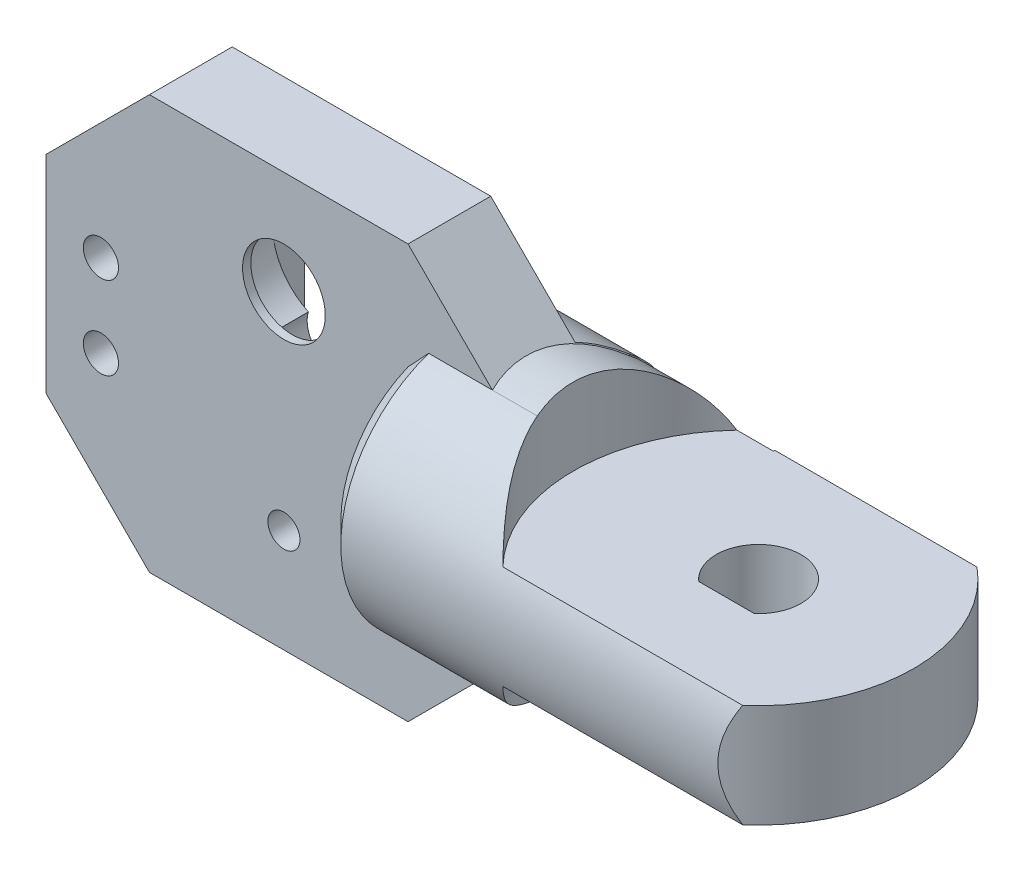
from build123d import *

# Parameters (mm, degrees)
SKETCH_1_W           = 50
SKETCH_1_H           = 40
EXTRUDE_1_DEPTH      = 8
CHAMFER_1_SIZE       = 10
SKETCH_2_R           = 1.55
CUT_EXTRUDE_1_DEPTH  = 10
EXTRUDE_2_DEPTH      = 30
EXTRUDE_2_DEPTH_BACK = 15
SKETCH_3_R           = 12.5
SKETCH_4_R           = 1.7
CUT_EXTRUDE_2_DEPTH  = 15
CUT_EXTRUDE_START    = -20
CUT_EXTRUDE_3_DEPTH  = 20
SKETCH_7_R           = 16.5
CUT_EXTRUDE_8_DEPTH  = 33
CUT_EXTRUDE_9_DEPTH  = 20
CHAMFER_3_SIZE       = 2
CUT_EXTRUDE_START_2  = 20
SKETCH_10_OUTSIDE_W  = 45.574
SKETCH_10_OUTSIDE_H  = 60.574
SKETCH_10_OUTSIDE_R  = 12.466047995
CUT_EXTRUDE_10_DEPTH = 10
CHAMFER_4_SIZE       = 10
SKETCH_14_W          = 12
SKETCH_14_H          = 23
CUT_EXTRUDE_11_DEPTH = 3
CUT_EXTRUDE_12_DEPTH = 4.2
SKETCH_16_R          = 1.1
CUT_EXTRUDE_13_DEPTH = 5
SKETCH_17_R          = 3.372674955
EXTRUDE_3_DEPTH      = 4
SKETCH_18_R          = 1.1
CUT_EXTRUDE_14_DEPTH = 4
SKETCH_20_R          = 4
CUT_EXTRUDE_15_DEPTH = 4
CUT_EXTRUDE_17_DEPTH = 10


# Read off the part's stored shape, not the designer's step: 切除-拉伸3
with BuildPart() as part:
    # 草图1 → 凸台-拉伸1 (new body)
    with BuildSketch(Plane.XY):
        Rectangle(SKETCH_1_W, SKETCH_1_H)
    extrude(amount=EXTRUDE_1_DEPTH)

    # 倒角1
    chamfer_1_edges = [part.edges().sort_by_distance(p)[0] for p in [
        (-25, -20, 4),
        (-25, 20, 4),
    ]]
    chamfer(chamfer_1_edges, length=CHAMFER_1_SIZE)

    # 草图2 → 切除-拉伸1 (cut)
    with BuildSketch(Plane.XY.offset(8)):
        with Locations((-2, -10)):
            Circle(SKETCH_2_R)
        with Locations((-2, 10)):
            Circle(SKETCH_2_R)
    extrude(amount=-CUT_EXTRUDE_1_DEPTH, mode=Mode.SUBTRACT)

    # 草图3 → 凸台-拉伸2 (add, two sides: drawn at the far end of the back side and taken through both)
    with BuildSketch(Plane(origin=(25, 0, 0), x_dir=(0, 0, -1), z_dir=(1, 0, 0)).offset(-EXTRUDE_2_DEPTH_BACK)):
        with Locations(Location((-4, 0, 0), (0, 0, 251.337075115))):
            Circle(SKETCH_3_R)
    extrude(amount=EXTRUDE_2_DEPTH + EXTRUDE_2_DEPTH_BACK)

    # 草图4 → 切除-拉伸2 (cut)
    with BuildSketch(Plane.XY.offset(8)):
        with Locations((-19.690178066, -4)):
            Circle(SKETCH_4_R)
        with Locations((-19.690178066, 4)):
            Circle(SKETCH_4_R)
    extrude(amount=-CUT_EXTRUDE_2_DEPTH, mode=Mode.SUBTRACT)

    # 切除-拉伸3 outline → 切除-拉伸3 (cut)
    with BuildSketch(Plane(origin=(55, 0, 0), x_dir=(0, 0, -1), z_dir=(1, 0, 0)).offset(CUT_EXTRUDE_START)):
        with BuildLine():
            Line((7.456439237, -5), (-15.456439237, -5))
            ThreePointArc((-15.456439237, -5), (-4, -12.5), (7.456439237, -5))
        make_face()
        with BuildLine():
            ThreePointArc((7.456439237, 5), (-4, 12.5), (-15.456439237, 5))
            Line((-15.456439237, 5), (7.456439237, 5))
        make_face()
    extrude(amount=CUT_EXTRUDE_3_DEPTH, mode=Mode.SUBTRACT)

    # 草图7 → 切除-拉伸8 (cut)
    with BuildSketch(Plane.XZ.offset(5)):
        with Locations((38.5, 4)):
            Circle(SKETCH_7_R)
    cut_extrude_8 = extrude(amount=CUT_EXTRUDE_8_DEPTH, mode=Mode.SUBTRACT)

    # 镜向1: 切除-拉伸8 across plane
    add(cut_extrude_8.mirror(Plane.ZX), mode=Mode.SUBTRACT)

    # 草图8 → 切除-拉伸9 (cut)
    with BuildSketch(Plane.XZ.offset(5)):
        with BuildLine():
            Line((40, 19.107397707), (75.764252489, 33.62580965))
            Line((75.764252489, 33.62580965), (78.826270749, -18.347337912))
            Line((78.826270749, -18.347337912), (40, -10.892602293))
            ThreePointArc((40, -10.892602293), (55, 4.107397707), (40, 19.107397707))
        make_face()
    extrude(amount=-CUT_EXTRUDE_9_DEPTH, mode=Mode.SUBTRACT)

    # 倒角3
    chamfer_3_edges = [part.edges().sort_by_distance(p)[0] for p in [
        (10, 0, 16.5),
        (10, 0, -8.5),
    ]]
    chamfer(chamfer_3_edges, length=CHAMFER_3_SIZE)

    # 草图10 outside → 切除-拉伸10 (cut)
    with BuildSketch(Plane(origin=(10, 0, 0), x_dir=(0, 0, -1), z_dir=(1, 0, 0)).offset(CUT_EXTRUDE_START_2)):
        with Locations((-4, 0)):
            Rectangle(SKETCH_10_OUTSIDE_W, SKETCH_10_OUTSIDE_H)
        with Locations((-4.107397707, 0)):
            Circle(SKETCH_10_OUTSIDE_R, mode=Mode.SUBTRACT)
    extrude(amount=-CUT_EXTRUDE_10_DEPTH, mode=Mode.SUBTRACT)

    # 倒角4
    # the kernel refuses this chamfer: 10 mm, written as the material it takes off along each edge
    with BuildSketch(Plane(origin=(20, -20, -25.71682988), x_dir=(-0.9996219169112968, -0.027495876610586317, 0), z_dir=(0, 0, 1))) as chamfer_4_piece_1_section:
        Polygon((CHAMFER_4_SIZE * 0.999621916911, -CHAMFER_4_SIZE * 0.0274958766106), (-CHAMFER_4_SIZE * 0.0274958766106, -CHAMFER_4_SIZE * 0.999621916911), (0, 0), align=None)
    chamfer_4_piece_1 = extrude(amount=59.433659759, mode=Mode.PRIVATE)
    chamfer_4_piece_1 = chamfer_4_piece_1 - Plane(origin=(16.670068992, 0, 4.107397707), x_dir=(0, 0, -1), z_dir=(1, 0, 0)) * Cylinder(12.466047995, 159, mode=Mode.PRIVATE)
    add(chamfer_4_piece_1, mode=Mode.SUBTRACT)
    with BuildSketch(Plane(origin=(20, 20, 33.71682988), x_dir=(-0.9996219169112968, 0.027495876610586317, 0), z_dir=(0, 0, -1))) as chamfer_4_piece_2_section:
        Polygon((CHAMFER_4_SIZE * 0.999621916911, -CHAMFER_4_SIZE * 0.0274958766106), (-CHAMFER_4_SIZE * 0.0274958766106, -CHAMFER_4_SIZE * 0.999621916911), (0, 0), align=None)
    chamfer_4_piece_2 = extrude(amount=59.433659759, mode=Mode.PRIVATE)
    chamfer_4_piece_2 = chamfer_4_piece_2 - Plane(origin=(16.670068992, 0, 4.107397707), x_dir=(0, 0, -1), z_dir=(1, 0, 0)) * Cylinder(12.466047995, 159, mode=Mode.PRIVATE)
    add(chamfer_4_piece_2, mode=Mode.SUBTRACT)

    # 草图14 → 切除-拉伸11 (cut)
    with BuildSketch(Plane(origin=(0, 0, 0), x_dir=(-1, 0, 0), z_dir=(0, 0, -1))):
        with Locations((2, 4.65)):
            Rectangle(SKETCH_14_W, SKETCH_14_H)
    extrude(amount=-CUT_EXTRUDE_11_DEPTH, mode=Mode.SUBTRACT)

    # 草图15 → 切除-拉伸12 (cut)
    with BuildSketch(Plane(origin=(0, 0, 3), x_dir=(-1, 0, 0), z_dir=(0, 0, -1))):
        with BuildLine():
            ThreePointArc((4.631967524, 4.49702381), (2, 16.1), (-0.631967524, 4.49702381))
            ThreePointArc((-0.631967524, 4.49702381), (2, 0.95), (4.631967524, 4.49702381))
        make_face()
    extrude(amount=-CUT_EXTRUDE_12_DEPTH, mode=Mode.SUBTRACT)

    # 草图16 → 切除-拉伸13 (cut)
    with BuildSketch(Plane(origin=(0, 0, 0), x_dir=(-1, 0, 0), z_dir=(0, 0, -1))):
        with Locations((2, 18.3)):
            Circle(SKETCH_16_R)
    extrude(amount=-CUT_EXTRUDE_13_DEPTH, mode=Mode.SUBTRACT)

    # 草图17 → 凸台-拉伸3 (add)
    with BuildSketch(Plane(origin=(0, 0, 0), x_dir=(-1, 0, 0), z_dir=(0, 0, -1))):
        with Locations((2, -10)):
            Circle(SKETCH_17_R)
    extrude(amount=-EXTRUDE_3_DEPTH)

    # 草图18 → 切除-拉伸14 (cut)
    with BuildSketch(Plane(origin=(0, 0, 0), x_dir=(-1, 0, 0), z_dir=(0, 0, -1))):
        with Locations((2, -9)):
            Circle(SKETCH_18_R)
    extrude(amount=-CUT_EXTRUDE_14_DEPTH, mode=Mode.SUBTRACT)

    # 草图20 → 切除-拉伸15 (cut)
    with BuildSketch(Plane(origin=(0, 0, 7.2), x_dir=(-1, 0, 0), z_dir=(0, 0, -1))):
        with Locations((2, 10)):
            Circle(SKETCH_20_R)
    extrude(amount=-CUT_EXTRUDE_15_DEPTH, mode=Mode.SUBTRACT)

    # 草图21 → 切除-拉伸17 (cut)
    with BuildSketch(Plane.XZ.offset(5)):
        with BuildLine():
            Line((42.683281573, 7.207397707), (37.316718427, 7.207397707))
            ThreePointArc((37.316718427, 7.207397707), (38.295807295, 0.378359329), (44.1, 4.107397707))
            ThreePointArc((44.1, 4.107397707), (43.729038378, 5.811590412), (42.683281573, 7.207397707))
        make_face()
    extrude(amount=-CUT_EXTRUDE_17_DEPTH, mode=Mode.SUBTRACT)


solid = part.part
